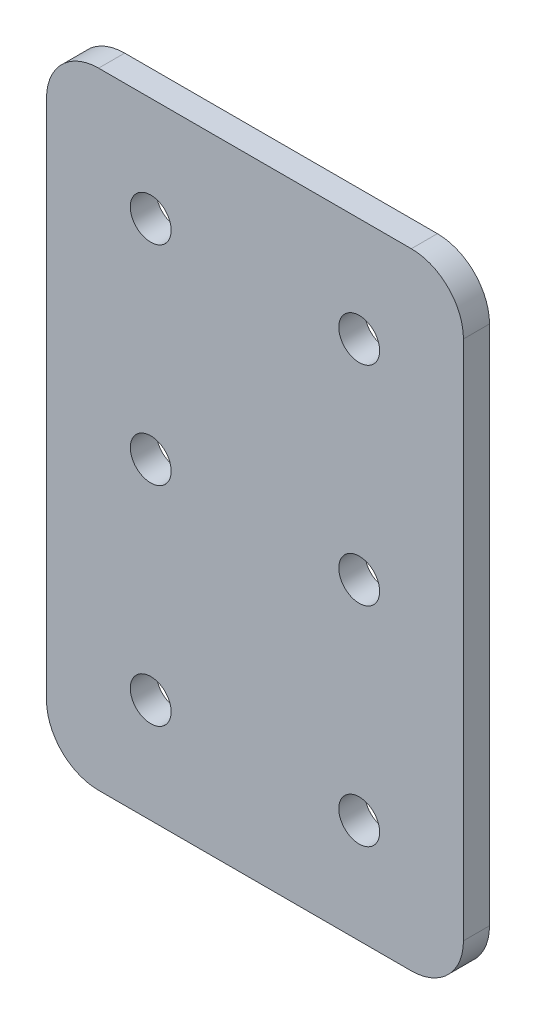
from build123d import *

# Parameters (mm, degrees)
SKETCH2_W           = 50.8
SKETCH2_H           = 76.2
BOSS_EXTRUDE1_DEPTH = 3.175
SKETCH3_R           = 2.4892
CUT_EXTRUDE1_DEPTH  = 92.636022529
FILLET1_R           = 6.35


with BuildPart() as part:
    # Sketch2 → Boss-Extrude1 (new body)
    with BuildSketch(Plane.XY):
        with Locations((25.4, 38.1)):
            Rectangle(SKETCH2_W, SKETCH2_H)
    extrude(amount=-BOSS_EXTRUDE1_DEPTH)

    # Sketch3 → Cut-Extrude1 (cut, through all)
    with BuildSketch(Plane.XY):
        with Locations((12.7, 63.5)):
            Circle(SKETCH3_R)
        with Locations((38.1, 63.5)):
            Circle(SKETCH3_R)
        with Locations((12.7, 38.1)):
            Circle(SKETCH3_R)
        with Locations((12.7, 12.7)):
            Circle(SKETCH3_R)
        with Locations((38.1, 38.1)):
            Circle(SKETCH3_R)
        with Locations((38.1, 12.7)):
            Circle(SKETCH3_R)
    extrude(amount=-CUT_EXTRUDE1_DEPTH, mode=Mode.SUBTRACT)

    # Fillet1
    fillet1_edges = [part.edges().sort_by_distance(p)[0] for p in [
        (0, 0, -1.5875),
        (50.8, 0, -1.5875),
        (50.8, 76.2, -1.5875),
        (0, 76.2, -1.5875),
    ]]
    fillet(fillet1_edges, radius=FILLET1_R)


solid = part.part
